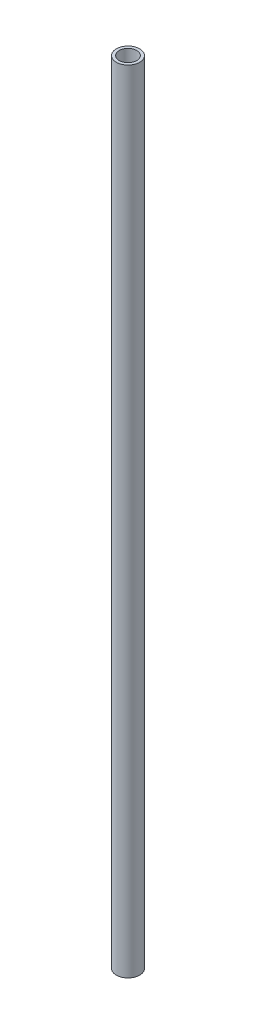
from build123d import *

# Parameters (mm, degrees)
SKETCH1_R           = 6.35
SKETCH1_R_2         = 4.7625
BOSS_EXTRUDE1_DEPTH = 429.895


with BuildPart() as part:
    # Sketch1 → Boss-Extrude1 (new body)
    with BuildSketch(Plane(origin=(0, 0, 0), x_dir=(1, 0, 0), z_dir=(0, 1, 0))):
        Circle(SKETCH1_R)
        Circle(SKETCH1_R_2, mode=Mode.SUBTRACT)
    extrude(amount=BOSS_EXTRUDE1_DEPTH)


solid = part.part
